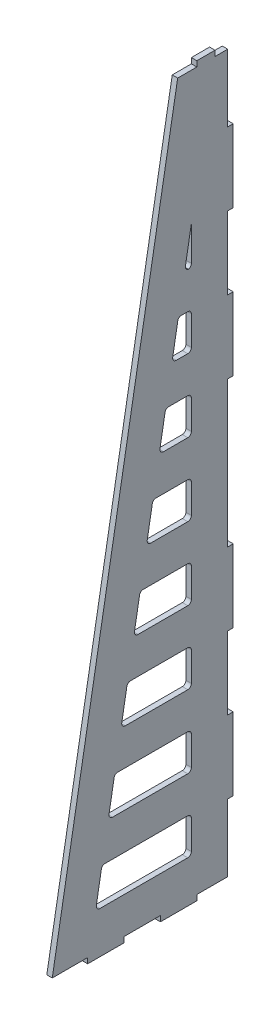
from build123d import *

# Parameters (mm, degrees)
BOSS_EXTRUDE1_DEPTH = 3
SKETCH2_W           = 20
SKETCH2_H           = 3
SKETCH2_W_2         = 3
SKETCH2_H_2         = 40
SKETCH2_H_3         = 80
CUT_EXTRUDE1_DEPTH  = 3
CUT_EXTRUDE2_DEPTH  = 3
FILLET1_R           = 2


with BuildPart() as part:
    # Sketch1 → Boss-Extrude1 (new body)
    with BuildSketch(Plane(origin=(0, 0, 0), x_dir=(0, 0, -1), z_dir=(1, 0, 0))):
        Polygon((0, 183.89261745), (0, -216.10738255), (-100, -216.10738255), (-30, 183.89261745), align=None)
    extrude(amount=BOSS_EXTRUDE1_DEPTH)

    # Sketch2 → Cut-Extrude1 (cut)
    with BuildSketch(Plane(origin=(3, 0, 0), x_dir=(0, 0, -1), z_dir=(1, 0, 0))):
        Polygon((-80, -213.10738255), (-99.475, -213.10738255), (-100, -216.10738255), (-80, -216.10738255), align=None)
        Polygon((-30, 183.89261745), (-30.525, 180.89261745), (-20, 180.89261745), (-20, 183.89261745), align=None)
        with Locations((-50, -214.60738255)):
            Rectangle(SKETCH2_W, SKETCH2_H)
        Polygon((-3, -213.10738255), (-20, -213.10738255), (-20, -216.10738255), (0, -216.10738255), (0, -176.10738255), (-3, -176.10738255), align=None)
        Polygon((-10, 183.89261745), (-10, 180.89261745), (-3, 180.89261745), (-3, 143.89261745), (0, 143.89261745), (0, 183.89261745), align=None)
        with Locations((-1.5, -116.10738255)):
            Rectangle(SKETCH2_W_2, SKETCH2_H_2)
        with Locations((-1.5, 83.89261745)):
            Rectangle(SKETCH2_W_2, SKETCH2_H_2)
        with Locations((-1.5, -16.10738255)):
            Rectangle(SKETCH2_W_2, SKETCH2_H_3)
    extrude(amount=-CUT_EXTRUDE1_DEPTH, mode=Mode.SUBTRACT)

    # Sketch3 → Cut-Extrude2 (cut)
    with BuildSketch(Plane(origin=(3, 0, 0), x_dir=(0, 0, -1), z_dir=(1, 0, 0))):
        Polygon((-68.671059496, -153.10738255), (-65.171059496, -133.10738255), (-23, -133.10738255), (-23, -153.10738255), align=None)
        Polygon((-23, -173.10738255), (-23, -193.10738255), (-75.671059496, -193.10738255), (-72.171059496, -173.10738255), align=None)
        Polygon((-61.671059496, -113.10738255), (-58.171059496, -93.10738255), (-23, -93.10738255), (-23, -113.10738255), align=None)
        Polygon((-54.671059496, -73.10738255), (-51.171059496, -53.10738255), (-23, -53.10738255), (-23, -73.10738255), align=None)
        Polygon((-23, 107.870100283), (-23, 86.89261745), (-26.671059496, 86.89261745), align=None)
        Polygon((-23, -33.10738255), (-47.671059496, -33.10738255), (-44.171059496, -13.10738255), (-23, -13.10738255), align=None)
        Polygon((-23, 6.89261745), (-40.671059496, 6.89261745), (-37.171059496, 26.89261745), (-23, 26.89261745), align=None)
        Polygon((-23, 46.89261745), (-33.671059496, 46.89261745), (-30.171059496, 66.89261745), (-23, 66.89261745), align=None)
    extrude(amount=-CUT_EXTRUDE2_DEPTH, mode=Mode.SUBTRACT)

    # Fillet1
    # the kernel refuses this fillet: 2 mm, written as the material it adds along each edge
    with BuildSketch(Plane(origin=(3, 86.89261745, 26.671059496), x_dir=(0, 0, -1), z_dir=(-1, 0, 0)), Plane(origin=(3, 46.89261745, 33.671059496), x_dir=(0, 0, -1), z_dir=(-1, 0, 0)), Plane(origin=(3, 6.89261745, 40.671059496), x_dir=(0, 0, -1), z_dir=(-1, 0, 0)), Plane(origin=(3, -33.10738255, 47.671059496), x_dir=(0, 0, -1), z_dir=(-1, 0, 0)), Plane(origin=(3, -193.10738255, 75.671059496), x_dir=(0, 0, -1), z_dir=(-1, 0, 0))) as fillet1_piece_1:
        with BuildLine():
            CenterArc((FILLET1_R * 1.19019702521, -FILLET1_R), FILLET1_R, 90, 99.926245507)
            Line((FILLET1_R * 0.205166558057, -FILLET1_R * 1.17238033175), (0, 0))
            Line((0, 0), (FILLET1_R * 1.19019702521, 0))
        make_face()
    extrude(amount=3)
    with BuildSketch(Plane(origin=(3, 86.89261745, 23), x_dir=(0, 1, 0), z_dir=(-1, 0, 0)), Plane(origin=(3, 66.89261745, 23), x_dir=(0, 0, 1), z_dir=(-1, 0, 0)), Plane(origin=(3, 26.89261745, 23), x_dir=(0, 0, 1), z_dir=(-1, 0, 0)), Plane(origin=(3, -13.10738255, 23), x_dir=(0, 0, 1), z_dir=(-1, 0, 0)), Plane(origin=(3, -93.10738255, 23), x_dir=(0, 0, 1), z_dir=(-1, 0, 0)), Plane(origin=(3, -73.10738255, 23), x_dir=(0, 1, 0), z_dir=(-1, 0, 0)), Plane(origin=(3, -53.10738255, 23), x_dir=(0, 0, 1), z_dir=(-1, 0, 0)), Plane(origin=(3, -133.10738255, 23), x_dir=(0, 0, 1), z_dir=(-1, 0, 0)), Plane(origin=(3, -113.10738255, 23), x_dir=(0, 1, 0), z_dir=(-1, 0, 0)), Plane(origin=(3, -153.10738255, 23), x_dir=(0, 1, 0), z_dir=(-1, 0, 0)), Plane(origin=(3, -193.10738255, 23), x_dir=(0, 1, 0), z_dir=(-1, 0, 0))) as fillet1_piece_2:
        with BuildLine():
            CenterArc((FILLET1_R, -FILLET1_R), FILLET1_R, 90, 90)
            Line((0, -FILLET1_R), (0, 0))
            Line((0, 0), (FILLET1_R, 0))
        make_face()
    extrude(amount=3)
    with BuildSketch(Plane(origin=(3, 66.89261745, 30.171059496), x_dir=(0, -0.985030467155704, 0.17238033175224968), z_dir=(-1, 0, 0)), Plane(origin=(3, 26.89261745, 37.171059496), x_dir=(0, -0.9850304671557044, 0.172380331752247), z_dir=(-1, 0, 0)), Plane(origin=(3, -13.10738255, 44.171059496), x_dir=(0, -0.9850304671557039, 0.1723803317522504), z_dir=(-1, 0, 0)), Plane(origin=(3, -53.10738255, 51.171059496), x_dir=(0, -0.9850304671557039, 0.1723803317522504), z_dir=(-1, 0, 0)), Plane(origin=(3, -93.10738255, 58.171059496), x_dir=(0, -0.9850304671557047, 0.17238033175224557), z_dir=(-1, 0, 0)), Plane(origin=(3, -133.10738255, 65.171059496), x_dir=(0, -0.9850304671557039, 0.17238033175224987), z_dir=(-1, 0, 0)), Plane(origin=(3, -173.10738255, 72.171059496), x_dir=(0, -0.9850304671557039, 0.17238033175224987), z_dir=(-1, 0, 0))) as fillet1_piece_3:
        with BuildLine():
            CenterArc((FILLET1_R * 0.840197025212, -FILLET1_R), FILLET1_R, 90, 80.073754493)
            Line((-FILLET1_R * 0.144833441943, -FILLET1_R * 0.827619668248), (0, 0))
            Line((0, 0), (FILLET1_R * 0.840197025212, 0))
        make_face()
    extrude(amount=3)
    with BuildSketch(Plane(origin=(3, 46.89261745, 23), x_dir=(0, 0, 1), z_dir=(-1, 0, 0)), Plane(origin=(3, 6.89261745, 23), x_dir=(0, 0, 1), z_dir=(-1, 0, 0)), Plane(origin=(3, -33.10738255, 23), x_dir=(0, 0, 1), z_dir=(-1, 0, 0)), Plane(origin=(3, -173.10738255, 23), x_dir=(0, -1, 0), z_dir=(-1, 0, 0))) as fillet1_piece_4:
        with BuildLine():
            CenterArc((FILLET1_R, FILLET1_R), FILLET1_R, 180, 90)
            Line((0, FILLET1_R), (0, 0))
            Line((0, 0), (FILLET1_R, 0))
        make_face()
    extrude(amount=3)
    with BuildSketch(Plane(origin=(3, -73.10738255, 54.671059496), x_dir=(0, 0.985030467155704, -0.17238033175224923), z_dir=(-1, 0, 0)), Plane(origin=(3, -113.10738255, 61.671059496), x_dir=(0, 0.9850304671557042, -0.17238033175224837), z_dir=(-1, 0, 0)), Plane(origin=(3, -153.10738255, 68.671059496), x_dir=(0, 0.9850304671557039, -0.17238033175225026), z_dir=(-1, 0, 0))) as fillet1_piece_5:
        with BuildLine():
            CenterArc((FILLET1_R * 1.19019702521, FILLET1_R), FILLET1_R, 170.073754493, 99.926245507)
            Line((FILLET1_R * 0.205166558057, FILLET1_R * 1.17238033175), (0, 0))
            Line((0, 0), (FILLET1_R * 1.19019702521, 0))
        make_face()
    extrude(amount=3)


solid = part.part
